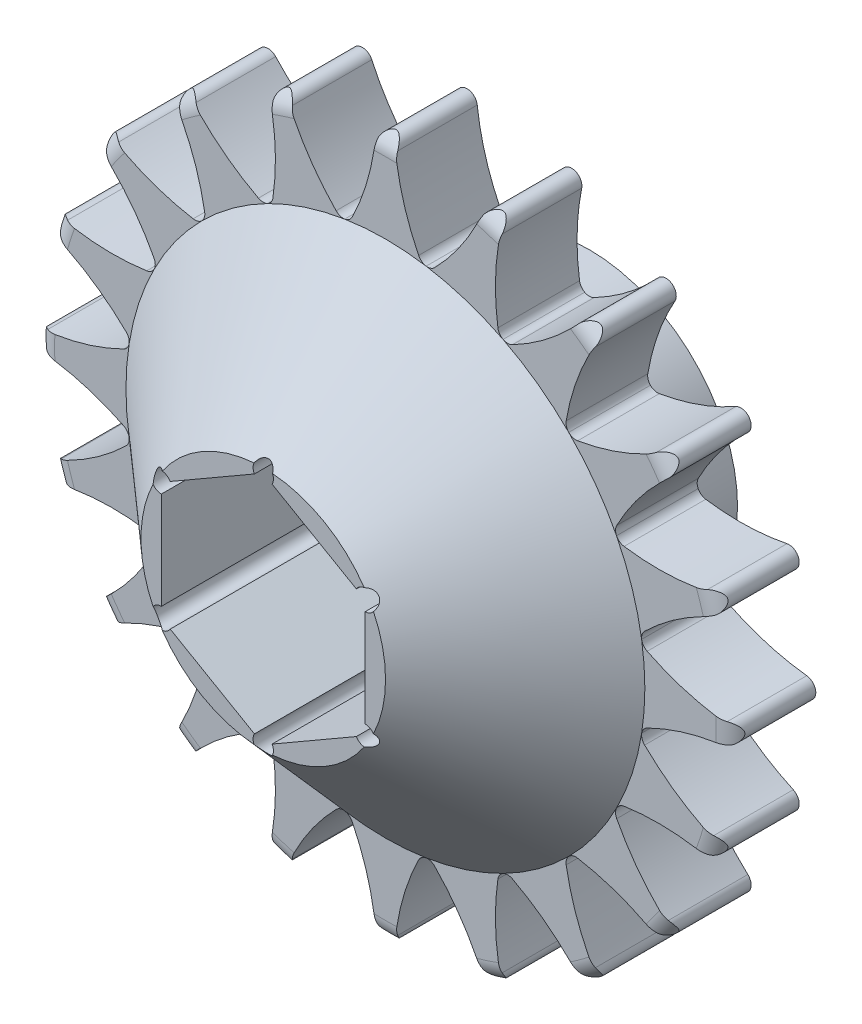
from build123d import *

# Parameters (mm, degrees)
BOSS_EXTRUDE1_DEPTH = 10
BOSS_EXTRUDE3_DEPTH = 10
BOSS_EXTRUDE4_DEPTH = 6
FILLET2_R           = 0.5
CIRPATTERN2_DEPTH   = 10


# Read off the part's stored shape, not the designer's step: CirPattern2
with BuildPart() as part:
    # Sketch2 → Boss-Extrude1 (new body)
    with BuildSketch(Plane.XY):
        with BuildLine():
            Line((-1.75, 12.611557946), (1.75, 12.611557946))
            ThreePointArc((1.75, 12.611557946), (0.938039397, 14.582853861), (0.5, 16.669336329))
            ThreePointArc((0.5, 16.669336329), (0, 17.114885217), (-0.5, 16.669336329))
            ThreePointArc((-0.5, 16.669336329), (-0.938039397, 14.582853861), (-1.75, 12.611557946))
        make_face()
    extrude(amount=BOSS_EXTRUDE1_DEPTH)

    # Sketch2<4> → Boss-Extrude3 (add)
    with BuildSketch(Plane.XY):
        with BuildLine():
            ThreePointArc((-1.75, 12.611557946), (0, -12.732395447), (1.75, 12.611557946))
            Line((1.75, 12.611557946), (-1.75, 12.611557946))
        make_face()
        with BuildLine():
            ThreePointArc((-0.433012702, 5.523502692), (0, 6.273502692), (0.433012702, 5.523502692))
            Line((0.433012702, 5.523502692), (4.566987298, 3.136751346))
            ThreePointArc((4.566987298, 3.136751346), (5.433012702, 3.136751346), (5, 2.386751346))
            Line((5, 2.386751346), (5, -2.386751346))
            ThreePointArc((5, -2.386751346), (5.433012702, -3.136751346), (4.566987298, -3.136751346))
            Line((4.566987298, -3.136751346), (0.433012702, -5.523502692))
            ThreePointArc((0.433012702, -5.523502692), (0, -6.273502692), (-0.433012702, -5.523502692))
            Line((-0.433012702, -5.523502692), (-4.566987298, -3.136751346))
            ThreePointArc((-4.566987298, -3.136751346), (-5.433012702, -3.136751346), (-5, -2.386751346))
            Line((-5, -2.386751346), (-5, 2.386751346))
            ThreePointArc((-5, 2.386751346), (-5.433012702, 3.136751346), (-4.566987298, 3.136751346))
            Line((-4.566987298, 3.136751346), (-0.433012702, 5.523502692))
        make_face(mode=Mode.SUBTRACT)
    extrude(amount=BOSS_EXTRUDE3_DEPTH)

    # Sketch2<5> → Boss-Extrude4 (add)
    with BuildSketch(Plane.XY):
        with BuildLine():
            ThreePointArc((0.99970424, 7.204473113), (0, 7.273502692), (-0.99970424, 7.204473113))
            Line((-0.99970424, 7.204473113), (-0.862259561, 6.213963669))
            ThreePointArc((-0.862259561, 6.213963669), (-0.432156351, 6.258600236), (0, 6.273502692))
            ThreePointArc((0, 6.273502692), (0.432156351, 6.258600236), (0.862259561, 6.213963669))
            Line((0.862259561, 6.213963669), (0.99970424, 7.204473113))
        make_face()
        with BuildLine():
            Line((-0.862259561, 6.213963669), (-0.99970424, 7.204473113))
            ThreePointArc((-0.99970424, 7.204473113), (-4.776635318, -5.485216171), (7.273502692, 0))
            ThreePointArc((7.273502692, 0), (5.485216171, 4.776635318), (0.99970424, 7.204473113))
            Line((0.99970424, 7.204473113), (0.862259561, 6.213963669))
            ThreePointArc((0.862259561, 6.213963669), (3.503558498, 5.20402862), (5.433012704, 3.136751343))
            ThreePointArc((5.433012704, 3.136751343), (6.059738272, 1.623701974), (6.273502692, 0))
            ThreePointArc((6.273502692, 0), (6.05973827, -1.62370198), (5.433012698, -3.136751353))
            ThreePointArc((5.433012698, -3.136751353), (3.136751344, -5.433012703), (3e-09, -6.273502692))
            ThreePointArc((3e-09, -6.273502692), (-3.136751339, -5.433012706), (-5.433012695, -3.136751357))
            ThreePointArc((-5.433012695, -3.136751357), (-6.273502692, -5e-09), (-5.4330127, 3.136751349))
            ThreePointArc((-5.4330127, 3.136751349), (-3.503558495, 5.204028622), (-0.862259561, 6.213963669))
        make_face()
    extrude(amount=-BOSS_EXTRUDE4_DEPTH)

    # Fillet2
    fillet2_edges = [part.edges().sort_by_distance(p)[0] for p in [
        (1.75, 12.611557946, 5),
        (-1.75, 12.611557946, 5),
    ]]
    fillet(fillet2_edges, radius=FILLET2_R)

    # CirPattern2 outline → CirPattern2 (add)
    with BuildSketch(Plane.XY):
        with BuildLine():
            ThreePointArc((-4.675579953, 16.007989436), (-5.288790389, 16.277223111), (-5.626636469, 15.698972441))
            ThreePointArc((-5.626636469, 15.698972441), (-5.401243132, 13.710891157), (-5.52033084, 11.713621154))
            ThreePointArc((-5.52033084, 11.713621154), (-5.608770074, 11.494781631), (-5.787743342, 11.340895945))
            ThreePointArc((-5.787743342, 11.340895945), (-3.942379627, 12.10667323), (-1.999941442, 12.574344041))
            ThreePointArc((-1.999941442, 12.574344041), (-2.226531714, 12.59866661), (-2.418792046, 12.721021438))
            ThreePointArc((-2.418792046, 12.721021438), (-3.689256776, 14.266961557), (-4.675579953, 16.007989436))
        make_face()
        with BuildLine():
            ThreePointArc((1.999941442, 12.574344041), (3.934526572, 12.109227658), (5.77302737, 11.348394107))
            ThreePointArc((5.77302737, 11.348394107), (5.604008437, 11.5012579), (5.520384924, 11.713252822))
            ThreePointArc((5.520384924, 11.713252822), (5.40123817, 13.710705083), (5.626636469, 15.698972441))
            ThreePointArc((5.626636469, 15.698972441), (5.288790389, 16.277223111), (4.675579953, 16.007989436))
            ThreePointArc((4.675579953, 16.007989436), (3.689256776, 14.266961557), (2.418792046, 12.721021438))
            ThreePointArc((2.418792046, 12.721021438), (2.226531714, 12.59866661), (1.999941442, 12.574344041))
        make_face()
        with BuildLine():
            ThreePointArc((5.77302737, 11.348394107), (7.477231785, 10.305576096), (8.997321938, 9.009000599))
            ThreePointArc((8.997321938, 9.009000599), (8.883812889, 9.206612427), (8.869792236, 9.434072666))
            ThreePointArc((8.869792236, 9.434072666), (9.373723633, 11.370581026), (10.202498557, 13.191883749))
            ThreePointArc((10.202498557, 13.191883749), (10.059877125, 13.846232997), (9.393481563, 13.779669002))
            ThreePointArc((9.393481563, 13.779669002), (7.917572898, 12.428757103), (6.231749524, 11.35113523))
            ThreePointArc((6.231749524, 11.35113523), (6.002721353, 11.294053428), (5.77302737, 11.348394107))
        make_face()
        with BuildLine():
            ThreePointArc((8.997321938, 9.009000599), (10.295868163, 7.490593607), (11.340895945, 5.787743342))
            ThreePointArc((11.340895945, 5.787743342), (11.294007838, 6.010759585), (11.350962485, 6.231419747))
            ThreePointArc((11.350962485, 6.231419747), (12.428643716, 7.917425277), (13.779669002, 9.393481563))
            ThreePointArc((13.779669002, 9.393481563), (13.846232997, 10.059877125), (13.191883749, 10.202498557))
            ThreePointArc((13.191883749, 10.202498557), (11.370756461, 9.373785852), (9.434439684, 8.86985462))
            ThreePointArc((9.434439684, 8.86985462), (9.198981703, 8.886340198), (8.997321938, 9.009000599))
        make_face()
        with BuildLine():
            ThreePointArc((11.340895945, 5.787743342), (12.10667323, 3.942379627), (12.574344041, 1.999941442))
            ThreePointArc((12.574344041, 1.999941442), (12.59866661, 2.226531714), (12.721021438, 2.418792046))
            ThreePointArc((12.721021438, 2.418792046), (14.266961557, 3.689256776), (16.007989436, 4.675579953))
            ThreePointArc((16.007989436, 4.675579953), (16.277223111, 5.288790389), (15.698972441, 5.626636469))
            ThreePointArc((15.698972441, 5.626636469), (13.710891157, 5.401243132), (11.713621154, 5.52033084))
            ThreePointArc((11.713621154, 5.52033084), (11.494781631, 5.608770074), (11.340895945, 5.787743342))
        make_face()
        with BuildLine():
            ThreePointArc((12.574344041, 1.999941442), (12.732392769, 0.00825806), (12.576927731, -1.983628662))
            ThreePointArc((12.576927731, -1.983628662), (12.670080115, -1.775644594), (12.845858181, -1.630603873))
            ThreePointArc((12.845858181, -1.630603873), (14.708729797, -0.900041882), (16.669336329, -0.5))
            ThreePointArc((16.669336329, -0.5), (17.114885217, 0), (16.669336329, 0.5))
            ThreePointArc((16.669336329, 0.5), (14.708908298, 0.899989101), (12.846191773, 1.630438616))
            ThreePointArc((12.846191773, 1.630438616), (12.665392244, 1.782174457), (12.574344041, 1.999941442))
        make_face()
        with BuildLine():
            ThreePointArc((12.576927731, -1.983628662), (12.111776992, -3.926671863), (11.348394107, -5.77302737))
            ThreePointArc((11.348394107, -5.77302737), (11.5012579, -5.604008437), (11.713252822, -5.520384924))
            ThreePointArc((11.713252822, -5.520384924), (13.710705083, -5.40123817), (15.698972441, -5.626636469))
            ThreePointArc((15.698972441, -5.626636469), (16.277223111, -5.288790389), (16.007989436, -4.675579953))
            ThreePointArc((16.007989436, -4.675579953), (14.267115011, -3.689362134), (12.721287635, -2.419052301))
            ThreePointArc((12.721287635, -2.419052301), (12.596226019, -2.218872814), (12.576927731, -1.983628662))
        make_face()
        with BuildLine():
            ThreePointArc((11.348394107, -5.77302737), (10.305576096, -7.477231785), (9.009000598, -8.997321937))
            ThreePointArc((9.009000598, -8.997321937), (9.206612427, -8.883812889), (9.434072666, -8.869792236))
            ThreePointArc((9.434072666, -8.869792236), (11.370581026, -9.373723633), (13.191883749, -10.202498557))
            ThreePointArc((13.191883749, -10.202498557), (13.846232997, -10.059877125), (13.779669002, -9.393481563))
            ThreePointArc((13.779669002, -9.393481563), (12.428757103, -7.917572898), (11.35113523, -6.231749524))
            ThreePointArc((11.35113523, -6.231749524), (11.294053428, -6.002721353), (11.348394107, -5.77302737))
        make_face()
        with BuildLine():
            ThreePointArc((9.009000598, -8.997321937), (7.490593607, -10.295868163), (5.787743342, -11.340895945))
            ThreePointArc((5.787743342, -11.340895945), (6.010759585, -11.294007838), (6.231419747, -11.350962485))
            ThreePointArc((6.231419747, -11.350962485), (7.917425277, -12.428643716), (9.393481563, -13.779669002))
            ThreePointArc((9.393481563, -13.779669002), (10.059877125, -13.846232997), (10.202498557, -13.191883749))
            ThreePointArc((10.202498557, -13.191883749), (9.373785852, -11.370756461), (8.86985462, -9.434439684))
            ThreePointArc((8.86985462, -9.434439684), (8.886340198, -9.198981703), (9.009000598, -8.997321937))
        make_face()
        with BuildLine():
            ThreePointArc((5.787743342, -11.340895945), (3.942379627, -12.10667323), (1.999941442, -12.57434404))
            ThreePointArc((1.999941442, -12.57434404), (2.226531714, -12.59866661), (2.418792046, -12.721021438))
            ThreePointArc((2.418792046, -12.721021438), (3.689256776, -14.266961557), (4.675579953, -16.007989436))
            ThreePointArc((4.675579953, -16.007989436), (5.288790389, -16.277223111), (5.626636469, -15.698972441))
            ThreePointArc((5.626636469, -15.698972441), (5.401243132, -13.710891157), (5.52033084, -11.713621154))
            ThreePointArc((5.52033084, -11.713621154), (5.608770074, -11.494781631), (5.787743342, -11.340895945))
        make_face()
        with BuildLine():
            ThreePointArc((1.999941442, -12.57434404), (0.00825806, -12.732392769), (-1.983628662, -12.576927731))
            ThreePointArc((-1.983628662, -12.576927731), (-1.775644594, -12.670080115), (-1.630603873, -12.845858181))
            ThreePointArc((-1.630603873, -12.845858181), (-0.900041882, -14.708729797), (-0.5, -16.669336329))
            ThreePointArc((-0.5, -16.669336329), (0, -17.114885217), (0.5, -16.669336329))
            ThreePointArc((0.5, -16.669336329), (0.899989101, -14.708908298), (1.630438616, -12.846191773))
            ThreePointArc((1.630438616, -12.846191773), (1.782174457, -12.665392244), (1.999941442, -12.57434404))
        make_face()
        with BuildLine():
            ThreePointArc((-1.983628662, -12.576927731), (-3.926671863, -12.111776992), (-5.77302737, -11.348394107))
            ThreePointArc((-5.77302737, -11.348394107), (-5.604008437, -11.5012579), (-5.520384924, -11.713252822))
            ThreePointArc((-5.520384924, -11.713252822), (-5.40123817, -13.710705083), (-5.626636469, -15.698972441))
            ThreePointArc((-5.626636469, -15.698972441), (-5.288790389, -16.277223111), (-4.675579953, -16.007989436))
            ThreePointArc((-4.675579953, -16.007989436), (-3.689362134, -14.267115011), (-2.419052301, -12.721287635))
            ThreePointArc((-2.419052301, -12.721287635), (-2.218872814, -12.596226019), (-1.983628662, -12.576927731))
        make_face()
        with BuildLine():
            ThreePointArc((-5.77302737, -11.348394107), (-7.477231785, -10.305576095), (-8.997321937, -9.009000598))
            ThreePointArc((-8.997321937, -9.009000598), (-8.883812889, -9.206612427), (-8.869792236, -9.434072666))
            ThreePointArc((-8.869792236, -9.434072666), (-9.373723633, -11.370581026), (-10.202498557, -13.191883749))
            ThreePointArc((-10.202498557, -13.191883749), (-10.059877125, -13.846232997), (-9.393481563, -13.779669002))
            ThreePointArc((-9.393481563, -13.779669002), (-7.917572898, -12.428757103), (-6.231749524, -11.35113523))
            ThreePointArc((-6.231749524, -11.35113523), (-6.002721353, -11.294053428), (-5.77302737, -11.348394107))
        make_face()
        with BuildLine():
            ThreePointArc((-8.997321937, -9.009000598), (-10.295868163, -7.490593607), (-11.340895945, -5.787743342))
            ThreePointArc((-11.340895945, -5.787743342), (-11.294007838, -6.010759585), (-11.350962485, -6.231419747))
            ThreePointArc((-11.350962485, -6.231419747), (-12.428643716, -7.917425277), (-13.779669002, -9.393481563))
            ThreePointArc((-13.779669002, -9.393481563), (-13.846232997, -10.059877125), (-13.191883749, -10.202498557))
            ThreePointArc((-13.191883749, -10.202498557), (-11.370756461, -9.373785852), (-9.434439684, -8.86985462))
            ThreePointArc((-9.434439684, -8.86985462), (-9.198981703, -8.886340198), (-8.997321937, -9.009000598))
        make_face()
        with BuildLine():
            ThreePointArc((-11.340895945, -5.787743342), (-12.10667323, -3.942379627), (-12.574344041, -1.999941442))
            ThreePointArc((-12.574344041, -1.999941442), (-12.59866661, -2.226531714), (-12.721021438, -2.418792046))
            ThreePointArc((-12.721021438, -2.418792046), (-14.266961557, -3.689256776), (-16.007989436, -4.675579953))
            ThreePointArc((-16.007989436, -4.675579953), (-16.277223111, -5.288790389), (-15.698972441, -5.626636469))
            ThreePointArc((-15.698972441, -5.626636469), (-13.710891157, -5.401243132), (-11.713621154, -5.52033084))
            ThreePointArc((-11.713621154, -5.52033084), (-11.494781631, -5.608770074), (-11.340895945, -5.787743342))
        make_face()
        with BuildLine():
            ThreePointArc((-12.574344041, -1.999941442), (-12.732392769, -0.00825806), (-12.576927731, 1.983628662))
            ThreePointArc((-12.576927731, 1.983628662), (-12.670080115, 1.775644594), (-12.845858181, 1.630603873))
            ThreePointArc((-12.845858181, 1.630603873), (-14.708729797, 0.900041882), (-16.669336329, 0.5))
            ThreePointArc((-16.669336329, 0.5), (-17.114885217, 0), (-16.669336329, -0.5))
            ThreePointArc((-16.669336329, -0.5), (-14.708908298, -0.899989101), (-12.846191773, -1.630438616))
            ThreePointArc((-12.846191773, -1.630438616), (-12.665392244, -1.782174457), (-12.574344041, -1.999941442))
        make_face()
        with BuildLine():
            ThreePointArc((-12.576927731, 1.983628662), (-12.111776992, 3.926671863), (-11.348394107, 5.77302737))
            ThreePointArc((-11.348394107, 5.77302737), (-11.5012579, 5.604008437), (-11.713252822, 5.520384924))
            ThreePointArc((-11.713252822, 5.520384924), (-13.710705083, 5.40123817), (-15.698972441, 5.626636469))
            ThreePointArc((-15.698972441, 5.626636469), (-16.277223111, 5.288790389), (-16.007989436, 4.675579953))
            ThreePointArc((-16.007989436, 4.675579953), (-14.267115011, 3.689362134), (-12.721287635, 2.419052301))
            ThreePointArc((-12.721287635, 2.419052301), (-12.596226019, 2.218872814), (-12.576927731, 1.983628662))
        make_face()
        with BuildLine():
            ThreePointArc((-11.348394107, 5.77302737), (-10.305576096, 7.477231785), (-9.009000599, 8.997321938))
            ThreePointArc((-9.009000599, 8.997321938), (-9.206612427, 8.883812889), (-9.434072666, 8.869792236))
            ThreePointArc((-9.434072666, 8.869792236), (-11.370581026, 9.373723633), (-13.191883749, 10.202498557))
            ThreePointArc((-13.191883749, 10.202498557), (-13.846232997, 10.059877125), (-13.779669002, 9.393481563))
            ThreePointArc((-13.779669002, 9.393481563), (-12.428757103, 7.917572898), (-11.35113523, 6.231749524))
            ThreePointArc((-11.35113523, 6.231749524), (-11.294053428, 6.002721353), (-11.348394107, 5.77302737))
        make_face()
        with BuildLine():
            ThreePointArc((-9.009000599, 8.997321938), (-7.490593608, 10.295868163), (-5.787743342, 11.340895945))
            ThreePointArc((-5.787743342, 11.340895945), (-6.010759585, 11.294007838), (-6.231419747, 11.350962485))
            ThreePointArc((-6.231419747, 11.350962485), (-7.917425277, 12.428643716), (-9.393481563, 13.779669002))
            ThreePointArc((-9.393481563, 13.779669002), (-10.059877125, 13.846232997), (-10.202498557, 13.191883749))
            ThreePointArc((-10.202498557, 13.191883749), (-9.373785852, 11.370756461), (-8.86985462, 9.434439684))
            ThreePointArc((-8.86985462, 9.434439684), (-8.886340198, 9.198981703), (-9.009000599, 8.997321938))
        make_face()
    extrude(amount=CIRPATTERN2_DEPTH)

    # Sketch4 → Cut-Revolve2 (revolve, cut)
    with BuildSketch(Plane(origin=(0, 0, 0), x_dir=(1, 0, 0), z_dir=(0, 1, 0))):
        with BuildLine():
            Line((12.732395447, -4.006269207), (6, -10))
            Line((6, -10), (17.232395447, -10))
            Line((17.232395447, -10), (17.232395447, -3.006269207))
            ThreePointArc((17.232395447, -3.006269207), (16.939502229, -3.713375988), (16.232395447, -4.006269207))
            Line((16.232395447, -4.006269207), (12.732395447, -4.006269207))
        make_face()
    revolve(axis=Axis((0, 0, 0), (0, 0, 1)), mode=Mode.SUBTRACT)


solid = part.part
